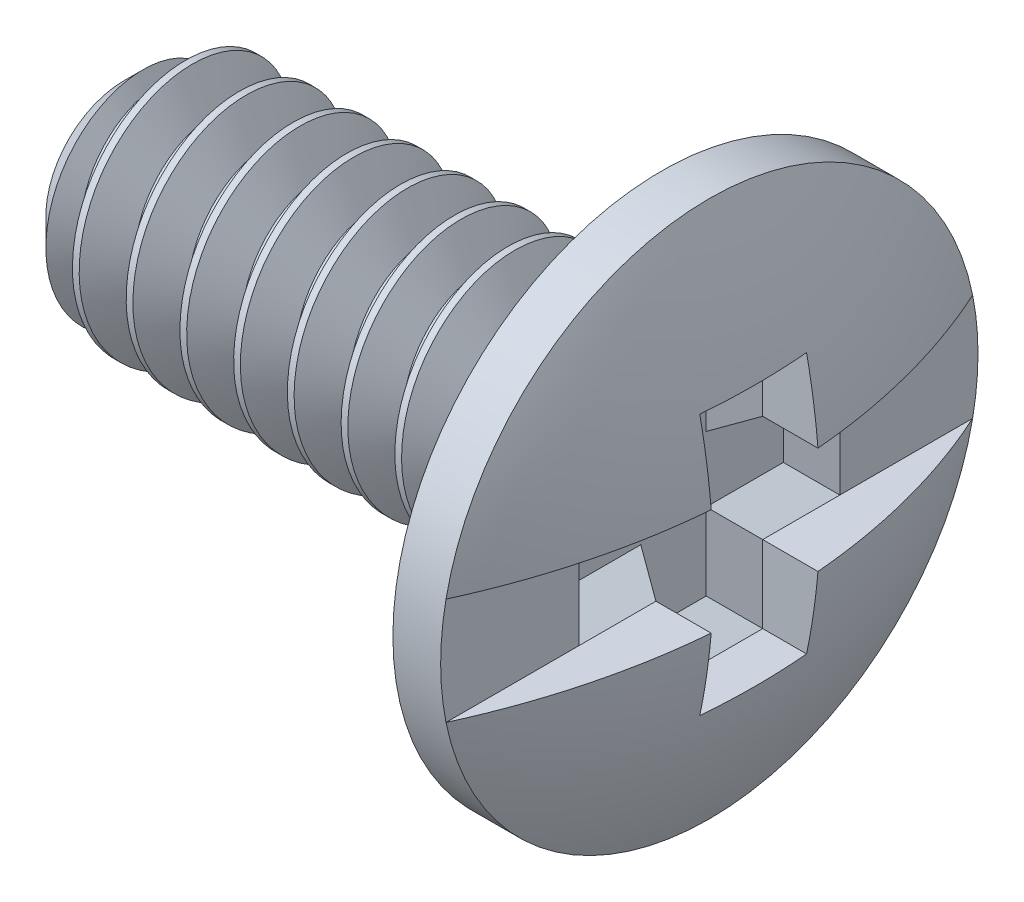
from build123d import *

# Parameters (mm, degrees)
SKETCH2_R                    = 1.7526
BOSS_EXTRUDE1_DEPTH          = 7.9375
CHAMFER1_SIZE                = 0.595313
SKETCH17_W                   = 7.9375
SKETCH17_H                   = 1.57734
CUT_EXTRUDE5_DEPTH           = 0.881944
SKETCH18_W                   = 1.57734
SKETCH18_H                   = 3.85572
CUT_EXTRUDE6_DEPTH           = 11.30555
CUT_EXTRUDE6_OTHER_WAY_DEPTH = 0.529167
CUT_EXTRUDE6_OTHER_WAY_TAPER = 30
CUT_SWEEP1_PITCH             = 0.79375
CUT_SWEEP1_TO                = 7.9375


with BuildPart() as part:
    # Sketch2 → Boss-Extrude1 (new body)
    with BuildSketch(Plane(origin=(0, 0, 0), x_dir=(0, 0, -1), z_dir=(1, 0, 0))):
        Circle(SKETCH2_R)
    extrude(amount=BOSS_EXTRUDE1_DEPTH)

    # Chamfer1
    chamfer1_edges = [part.edges().sort_by_distance(p)[0] for p in [
        (0, 0, 1.7526),
    ]]
    chamfer(chamfer1_edges, length=CHAMFER1_SIZE)

    # Cut-Sweep1: arcs per turn and ends read off the stored shape
    # Cut-Sweep1: the profile of Sketch5 profile screwed along a right-hand helix through 11 turns, 8 arcs to a turn; built about Z, then put on its axis
    cut_sweep1_z = Axis((0, 0, 0), (0, 0, 1))
    cut_sweep1_corners = [(1.7529, 0, 0.000173), (1.7529, 0, -0.694704), (1.237044, 0, -0.396875), (1.237044, 0, -0.297656)]
    with BuildLine(mode=Mode.PRIVATE) as cut_sweep1_profile:
        Line(cut_sweep1_corners[0], cut_sweep1_corners[1])
        Line(cut_sweep1_corners[1], cut_sweep1_corners[2])
        Line(cut_sweep1_corners[2], cut_sweep1_corners[3])
        Line(cut_sweep1_corners[3], cut_sweep1_corners[0])
    cut_sweep1_cap = Face(cut_sweep1_profile.wire())
    cut_sweep1_turn_angles = [0, 22.5, 45, 67.5, 90, 112.5, 135, 157.5, 180, 202.5, 225, 247.5, 270, 292.5, 315, 337.5, 360]
    cut_sweep1_turn_weights = [1, 0.9238795325112867, 1, 0.9238795325112867, 1, 0.9238795325112867, 1, 0.9238795325112867, 1, 0.9238795325112867, 1, 0.9238795325112867, 1, 0.9238795325112867, 1, 0.9238795325112867, 1]
    cut_sweep1_turn_rails = [Edge.make_bspline([Vector(p[0], p[1], 0).rotate(cut_sweep1_z, cut_sweep1_turn_angles[k]) / cut_sweep1_turn_weights[k] + Vector(0, 0, p[2] + CUT_SWEEP1_PITCH * cut_sweep1_turn_angles[k] / 360) for k in range(17)], [0, 0, 0, 1, 1, 2, 2, 3, 3, 4, 4, 5, 5, 6, 6, 7, 7, 8, 8, 8], 2, cut_sweep1_turn_weights) for p in cut_sweep1_corners]
    cut_sweep1_turn_sides = [Face.make_surface_from_curves(cut_sweep1_turn_rails[p[0]], cut_sweep1_turn_rails[p[1]]) for p in [(0, 1), (1, 2), (2, 3), (3, 0)]]
    cut_sweep1 = Plane(origin=(0, 0, 0), x_dir=(0, 1, 0), z_dir=(1, 0, 0)) * split(Solid(Shell([*[p.moved(Location((0, 0, CUT_SWEEP1_PITCH * i))) for i in range(11) for p in cut_sweep1_turn_sides], cut_sweep1_cap, cut_sweep1_cap.rotate(cut_sweep1_z, 3960).moved(Location((0, 0, CUT_SWEEP1_PITCH * 3960 / 360)))])), bisect_by=Plane.XY.offset(CUT_SWEEP1_TO), keep=Keep.BOTTOM, mode=Mode.PRIVATE)
    add(cut_sweep1, mode=Mode.SUBTRACT)


with BuildPart() as body_2:
    # Sketch6 → Revolve1 (revolve)
    with BuildSketch(Plane.XY):
        with BuildLine():
            Line((7.9375, 0), (7.9375, 3.96875))
            Line((7.9375, 3.96875), (8.643056, 3.96875))
            ThreePointArc((8.643056, 3.96875), (9.301857, 2.032782), (9.525, 0))
            Line((9.525, 0), (7.9375, 0))
        make_face()
    revolve(axis=Axis((7.9375, 0, 0), (1, 0, 0)))

    # Sketch17 → Cut-Extrude5 (cut)
    with BuildSketch(Plane(origin=(9.525, 0, 0), x_dir=(0, 0, -1), z_dir=(1, 0, 0))):
        Rectangle(SKETCH17_W, SKETCH17_H)
    extrude(amount=-CUT_EXTRUDE5_DEPTH, mode=Mode.SUBTRACT)

    # Sketch18 → Cut-Extrude6 (cut)
    with BuildSketch(Plane(origin=(8.643056, 0, 0), x_dir=(0, 0, -1), z_dir=(1, 0, 0))):
        Rectangle(SKETCH18_W, SKETCH18_H)
    extrude(amount=CUT_EXTRUDE6_DEPTH, mode=Mode.SUBTRACT)

    # Sketch18 → Cut-Extrude6 other way (cut)
    with BuildSketch(Plane(origin=(8.643056, 0, 0), x_dir=(0, 0, -1), z_dir=(1, 0, 0))):
        Rectangle(SKETCH18_W, SKETCH18_H)
    extrude(amount=-CUT_EXTRUDE6_OTHER_WAY_DEPTH, taper=CUT_EXTRUDE6_OTHER_WAY_TAPER, mode=Mode.SUBTRACT)

    # Cut-Extrude7: read off the stored shape, not the designer's step
    # Cut-Extrude7: loft between two sections, ruled curve by curve
    cut_extrude7_from = [
        Edge.make_line((8.643056, -0.78867, -0.78867), (8.113889, -0.483155, -0.483155)),
        Edge.make_line((8.113889, 0.483155, -0.483155), (8.643056, 0.78867, -0.78867)),
        Edge.make_line((8.113889, 0.483155, -0.483155), (8.113889, -0.483155, -0.483155)),
        Edge.make_line((8.643056, 0.78867, -0.78867), (8.643056, -0.78867, -0.78867)),
    ]
    cut_extrude7_to = [
        Edge.make_line((8.643056, -0.78867, -1.92786), (8.113889, -0.483155, -1.622345)),
        Edge.make_line((8.113889, 0.483155, -1.622345), (8.643056, 0.78867, -1.92786)),
        Edge.make_line((8.113889, 0.483155, -1.622345), (8.113889, -0.483155, -1.622345)),
        Edge.make_line((8.643056, 0.78867, -1.92786), (8.643056, -0.78867, -1.92786)),
    ]
    cut_extrude7 = Solid(Shell([*[Face.make_surface_from_curves(cut_extrude7_from[k], cut_extrude7_to[k]) for k in range(4)], Face(Wire(cut_extrude7_from)), Face(Wire(cut_extrude7_to))]))
    add(cut_extrude7, mode=Mode.SUBTRACT)

    # Cut-Extrude7 2: loft between two sections, ruled curve by curve
    cut_extrude7_2_from = [
        Edge.make_line((8.113889, -0.483155, 0.483155), (8.643056, -0.78867, 0.78867)),
        Edge.make_line((8.643056, 0.78867, 0.78867), (8.113889, 0.483155, 0.483155)),
        Edge.make_line((8.113889, 0.483155, 0.483155), (8.113889, -0.483155, 0.483155)),
        Edge.make_line((8.643056, 0.78867, 0.78867), (8.643056, -0.78867, 0.78867)),
    ]
    cut_extrude7_2_to = [
        Edge.make_line((8.113889, -0.483155, 1.622345), (8.643056, -0.78867, 1.92786)),
        Edge.make_line((8.643056, 0.78867, 1.92786), (8.113889, 0.483155, 1.622345)),
        Edge.make_line((8.113889, 0.483155, 1.622345), (8.113889, -0.483155, 1.622345)),
        Edge.make_line((8.643056, 0.78867, 1.92786), (8.643056, -0.78867, 1.92786)),
    ]
    cut_extrude7_2 = Solid(Shell([*[Face.make_surface_from_curves(cut_extrude7_2_from[k], cut_extrude7_2_to[k]) for k in range(4)], Face(Wire(cut_extrude7_2_from)), Face(Wire(cut_extrude7_2_to))]))
    add(cut_extrude7_2, mode=Mode.SUBTRACT)

    # Combine1: union part
    add(part.part)


solid = body_2.part
